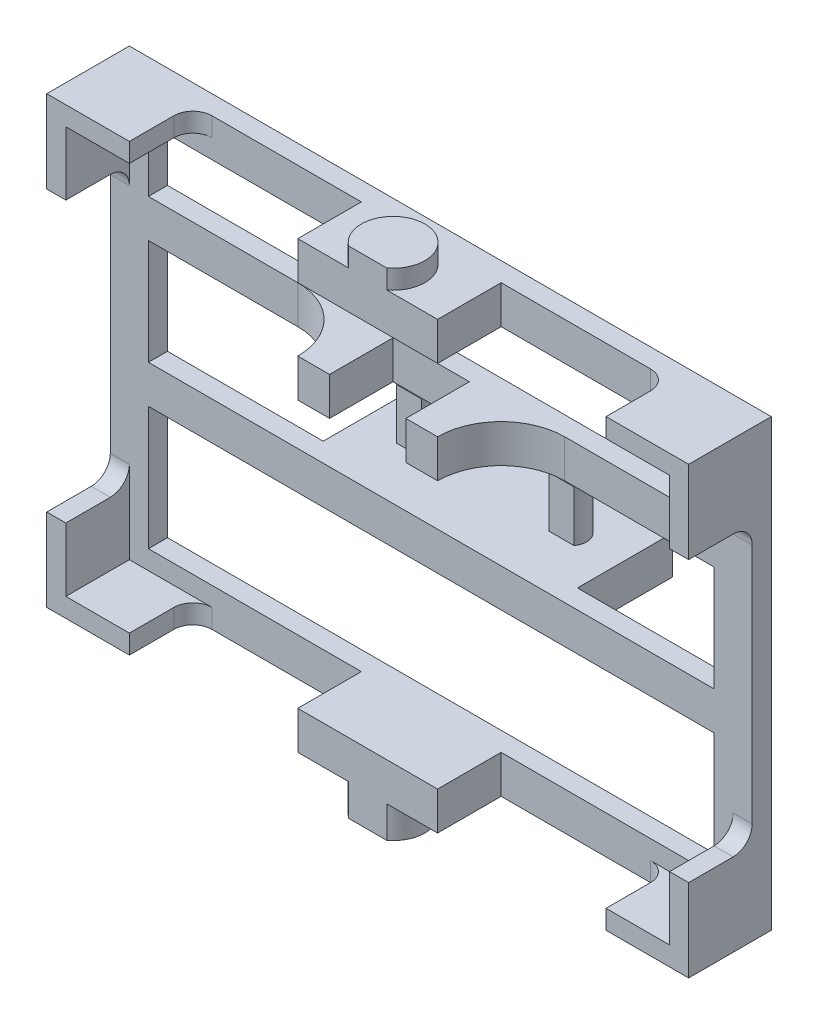
from build123d import *

# Parameters (mm, degrees)
CROQUIS1_W              = 101
CROQUIS1_H              = 70
CROQUIS1_W_2            = 89
CROQUIS1_H_2            = 58
CROQUIS1_H_3            = 6
SALIENTE_EXTRUIR1_DEPTH = 3
SALIENTE_EXTRUIR2_DEPTH = 10
CROQUIS3_W              = 5
CROQUIS3_H              = 6
SALIENTE_EXTRUIR3_DEPTH = 10
REDONDEO1_R             = 10
REDONDEO2_R             = 3
CROQUIS5_W              = 40
CROQUIS5_H              = 6
SALIENTE_EXTRUIR4_DEPTH = 15
CROQUIS6_R              = 2.45
SALIENTE_EXTRUIR5_DEPTH = 8
CROQUIS7_W              = 22
CROQUIS7_H              = 6
SALIENTE_EXTRUIR6_DEPTH = 10
CROQUIS8_R              = 5
SALIENTE_EXTRUIR7_DEPTH = 5
CROQUIS9_W              = 22
CROQUIS9_H              = 19.446808743
CORTAR_EXTRUIR1_DEPTH   = 119.004237212
CROQUIS10_W             = 28.262492251
CROQUIS10_H             = 3.390066726
CORTAR_EXTRUIR2_DEPTH   = 8


with BuildPart() as part:
    # Croquis1 → Saliente-Extruir1 (new body)
    # profile 1 of 3: a face of its own
    with BuildSketch(Plane.XY):
        with Locations((47.5, 32)):
            Rectangle(CROQUIS1_W, CROQUIS1_H)
        with Locations((47.5, 32)):
            Rectangle(CROQUIS1_W_2, CROQUIS1_H_2, mode=Mode.SUBTRACT)
    # profile 2 of 3: a face of its own
    with BuildSketch(Plane.XY):
        with Locations((47.5, 48)):
            Rectangle(CROQUIS1_W_2, CROQUIS1_H_3)
    # profile 3 of 3: a face of its own
    with BuildSketch(Plane.XY):
        with Locations((47.5, 25.4)):
            Rectangle(CROQUIS1_W_2, CROQUIS1_H_3)
    extrude(amount=SALIENTE_EXTRUIR1_DEPTH)

    # Croquis2 → Saliente-Extruir2 (add)
    with BuildSketch(Plane.XY.offset(3)):
        Polygon((85, 67), (98, 67), (98, 54), (95, 54), (95, 64), (85, 64), align=None)
        Polygon((10, 64), (10, 67), (-3, 67), (-3, 54), (0, 54), (0, 64), align=None)
        Polygon((10, -3), (-3, -3), (-3, 10), (0, 10), (0, 0), (10, 0), align=None)
        Polygon((85, 0), (85, -3), (98, -3), (98, 10), (95, 10), (95, 0), align=None)
    extrude(amount=SALIENTE_EXTRUIR2_DEPTH)

    # Croquis3 → Saliente-Extruir3 (add)
    with BuildSketch(Plane.XY.offset(3)):
        with Locations((56, 48)):
            Rectangle(CROQUIS3_W, CROQUIS3_H)
        with Locations((39, 48)):
            Rectangle(CROQUIS3_W, CROQUIS3_H)
    extrude(amount=SALIENTE_EXTRUIR3_DEPTH)

    # Redondeo1
    redondeo1_edges = [part.edges().sort_by_distance(p)[0] for p in [
        (36.5, 48, 3),
        (58.5, 48, 3),
    ]]
    fillet(redondeo1_edges, radius=REDONDEO1_R - 0.0001)  # a hair under: the kernel refuses the full size

    # Redondeo2
    redondeo2_edges = [part.edges().sort_by_distance(p)[0] for p in [
        (85, -1.5, 3),
        (96.5, 10, 3),
        (85, 65.5, 3),
        (96.5, 54, 3),
        (10, 65.5, 3),
        (-1.5, 54, 3),
        (10, -1.5, 3),
        (-1.5, 10, 3),
    ]]
    fillet(redondeo2_edges, radius=REDONDEO2_R)

    # Croquis5 → Saliente-Extruir4 (add)
    with BuildSketch(Plane(origin=(0, 0, 0), x_dir=(-1, 0, 0), z_dir=(0, 0, -1))):
        with Locations((-47.5, 25.4)):
            Rectangle(CROQUIS5_W, CROQUIS5_H)
    extrude(amount=SALIENTE_EXTRUIR4_DEPTH)

    # Croquis6 → Saliente-Extruir5 (add)
    with BuildSketch(Plane(origin=(0, 28.4, 0), x_dir=(1, 0, 0), z_dir=(0, 1, 0))):
        with Locations(Location((35.5, 7, 0), (0, 0, 270))):
            Circle(CROQUIS6_R)
        with Locations(Location((59.5, 7, 0), (0, 0, 270))):
            Circle(CROQUIS6_R)
    extrude(amount=SALIENTE_EXTRUIR5_DEPTH)

    # Croquis7 → Saliente-Extruir6 (add, through all)
    with BuildSketch(Plane.XY.offset(3)):
        with Locations((47.5, 0)):
            Rectangle(CROQUIS7_W, CROQUIS7_H)
        with Locations((47.5, 64)):
            Rectangle(CROQUIS7_W, CROQUIS7_H)
    extrude(amount=SALIENTE_EXTRUIR6_DEPTH)

    # Croquis8 → Saliente-Extruir7 (add)
    with BuildSketch(Plane.XZ.offset(3)):
        with Locations(Location((47.5, 9, 0), (0, 0, 126.869897646))):
            Circle(CROQUIS8_R)
    saliente_extruir7 = extrude(amount=SALIENTE_EXTRUIR7_DEPTH)

    # Croquis9 → Cortar-Extruir1 (cut, through all)
    with BuildSketch(Plane(origin=(0, 3, 0), x_dir=(1, 0, 0), z_dir=(0, 1, 0))):
        with Locations((47.5, -22.723404372)):
            Rectangle(CROQUIS9_W, CROQUIS9_H)
    cortar_extruir1 = extrude(amount=-CORTAR_EXTRUIR1_DEPTH, mode=Mode.SUBTRACT)

    # Simetría1: Saliente-Extruir7, Cortar-Extruir1 across plane
    add(saliente_extruir7.mirror(Plane.ZX.offset(31)))
    add(cortar_extruir1.mirror(Plane.ZX.offset(31)), mode=Mode.SUBTRACT)

    # Croquis10 → Cortar-Extruir2 (cut)
    with BuildSketch(Plane(origin=(0, 36.4, 0), x_dir=(1, 0, 0), z_dir=(0, 1, 0))):
        with Locations((47.340282602, 3.804966637)):
            Rectangle(CROQUIS10_W, CROQUIS10_H)
    extrude(amount=-CORTAR_EXTRUIR2_DEPTH, mode=Mode.SUBTRACT)


solid = part.part
